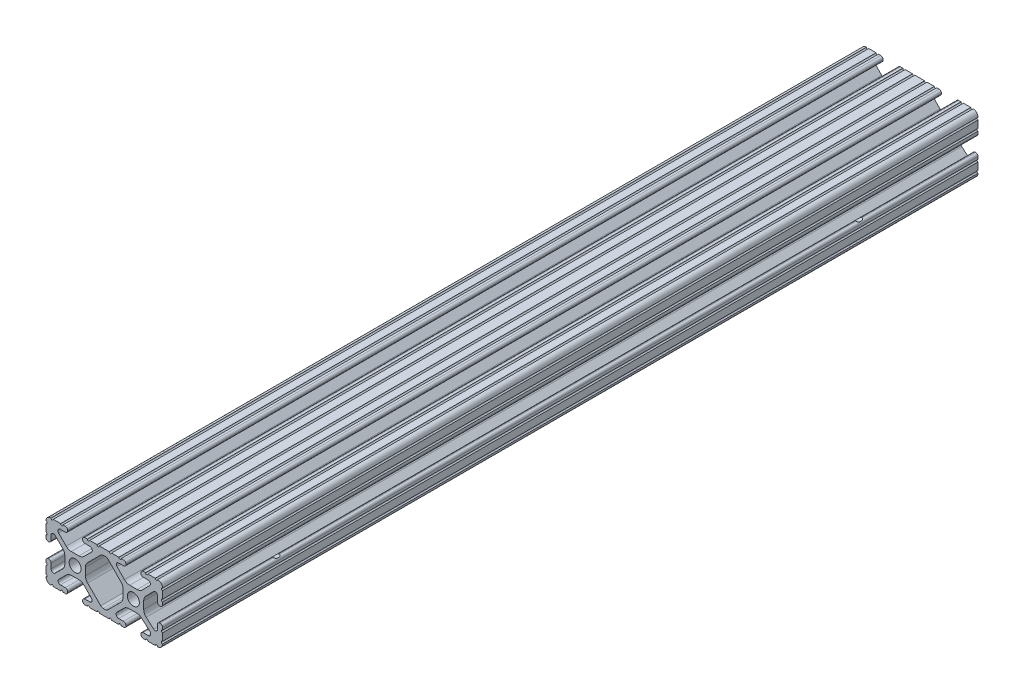
from build123d import *

# Parameters (mm, degrees)
SKETCH1_R           = 2.6035
BOSS_EXTRUDE1_DEPTH = 177.8
SKETCH2_R           = 3.5
CUT_EXTRUDE1_DEPTH  = 186.350397895


with BuildPart() as part:
    # Sketch1 → Boss-Extrude1 (new, symmetric)
    with BuildSketch(Plane.XY):
        with BuildLine():
            Line((18.01710265, 12.7), (16.98745015, 12.7))
            ThreePointArc((16.98745015, 12.7), (16.245730386, 12.392769614), (15.9385, 11.65104985))
            Line((15.9385, 11.65104985), (15.9385, 11.53922))
            ThreePointArc((15.9385, 11.53922), (16.245750844, 10.797450844), (16.98752, 10.4902))
            Line((16.98752, 10.4902), (19.116384363, 10.4902))
            ThreePointArc((19.116384363, 10.4902), (20.052502933, 9.869096983), (19.844087081, 8.765172272))
            Line((19.844087081, 8.765172272), (16.618993479, 5.455112286))
            ThreePointArc((16.618993479, 5.455112286), (15.578994274, 4.745442459), (14.344932584, 4.4958))
            Line((14.344932584, 4.4958), (11.083317835, 4.4958))
            ThreePointArc((11.083317835, 4.4958), (9.854330953, 4.743306833), (8.816955189, 5.447238587))
            Line((8.816955189, 5.447238587), (5.564154119, 8.762652677))
            ThreePointArc((5.564154119, 8.762652677), (5.352591412, 9.867473037), (6.289393385, 10.4902))
            Line((6.289393385, 10.4902), (8.41248, 10.4902))
            ThreePointArc((8.41248, 10.4902), (9.154249156, 10.797450844), (9.4615, 11.53922))
            Line((9.4615, 11.53922), (9.4615, 11.65104985))
            ThreePointArc((9.4615, 11.65104985), (9.154269614, 12.392769614), (8.41254985, 12.7))
            Line((8.41254985, 12.7), (7.38288465, 12.7))
            ThreePointArc((7.38288465, 12.7), (6.87488465, 12.192), (6.36688465, 12.7))
            Line((6.36688465, 12.7), (3.14958095, 12.7))
            ThreePointArc((3.14958095, 12.7), (2.64158095, 12.192), (2.13358095, 12.7))
            Line((2.13358095, 12.7), (-2.13358095, 12.7))
            ThreePointArc((-2.13358095, 12.7), (-2.64158095, 12.192), (-3.14958095, 12.7))
            Line((-3.14958095, 12.7), (-6.36689735, 12.7))
            ThreePointArc((-6.36689735, 12.7), (-6.87489735, 12.192), (-7.38289735, 12.7))
            Line((-7.38289735, 12.7), (-8.41254985, 12.7))
            ThreePointArc((-8.41254985, 12.7), (-9.154269614, 12.392769614), (-9.4615, 11.65104985))
            Line((-9.4615, 11.65104985), (-9.4615, 11.53922))
            ThreePointArc((-9.4615, 11.53922), (-9.154249156, 10.797450844), (-8.41248, 10.4902))
            Line((-8.41248, 10.4902), (-6.283641037, 10.4902))
            ThreePointArc((-6.283641037, 10.4902), (-5.297291557, 9.829633109), (-5.532576693, 8.666071843))
            Line((-5.532576693, 8.666071843), (-8.809985098, 5.416263103))
            ThreePointArc((-8.809985098, 5.416263103), (-9.836720513, 4.734920264), (-11.045536121, 4.4958))
            Line((-11.045536121, 4.4958), (-14.354463879, 4.4958))
            ThreePointArc((-14.354463879, 4.4958), (-15.563279487, 4.734920264), (-16.590014902, 5.416263103))
            Line((-16.590014902, 5.416263103), (-19.867423307, 8.666071843))
            ThreePointArc((-19.867423307, 8.666071843), (-20.102708443, 9.829633109), (-19.116358963, 10.4902))
            Line((-19.116358963, 10.4902), (-16.98752, 10.4902))
            ThreePointArc((-16.98752, 10.4902), (-16.245750844, 10.797450844), (-15.9385, 11.53922))
            Line((-15.9385, 11.53922), (-15.9385, 11.65104985))
            ThreePointArc((-15.9385, 11.65104985), (-16.245730386, 12.392769614), (-16.98745015, 12.7))
            Line((-16.98745015, 12.7), (-18.01711535, 12.7))
            ThreePointArc((-18.01711535, 12.7), (-18.52511535, 12.192), (-19.03311535, 12.7))
            Line((-19.03311535, 12.7), (-22.2504, 12.7))
            ThreePointArc((-22.2504, 12.7), (-22.758323491, 12.192000006), (-23.266399977, 12.699846982))
            ThreePointArc((-23.266399977, 12.699846982), (-24.782522516, 12.082522516), (-25.399846982, 10.566399977))
            ThreePointArc((-25.399846982, 10.566399977), (-24.892000006, 10.058323491), (-25.4, 9.5504))
            Line((-25.4, 9.5504), (-25.4, 6.3330836))
            ThreePointArc((-25.4, 6.3330836), (-24.892, 5.8250836), (-25.4, 5.3170836))
            Line((-25.4, 5.3170836), (-25.4, 4.237520184))
            ThreePointArc((-25.4, 4.237520184), (-25.107393763, 3.531106237), (-24.400979816, 3.2385))
            Line((-24.400979816, 3.2385), (-24.23922, 3.2385))
            ThreePointArc((-24.23922, 3.2385), (-23.497450844, 3.545750844), (-23.1902, 4.28752))
            Line((-23.1902, 4.28752), (-23.1902, 6.334741132))
            ThreePointArc((-23.1902, 6.334741132), (-22.556026952, 7.286023527), (-21.434002553, 7.066535717))
            Line((-21.434002553, 7.066535717), (-18.147950853, 3.808156468))
            ThreePointArc((-18.147950853, 3.808156468), (-17.452759693, 2.774838327), (-17.208501877, 1.553619571))
            Line((-17.208501877, 1.553619571), (-17.208501877, -1.695179196))
            ThreePointArc((-17.208501877, -1.695179196), (-17.450738657, -2.911536421), (-18.140486065, -3.942289578))
            Line((-18.140486065, -3.942289578), (-21.431579576, -7.227386226))
            ThreePointArc((-21.431579576, -7.227386226), (-22.55444896, -7.449940594), (-23.1902, -6.498002195))
            Line((-23.1902, -6.498002195), (-23.1902, -4.28752))
            ThreePointArc((-23.1902, -4.28752), (-23.497450844, -3.545750844), (-24.23922, -3.2385))
            Line((-24.23922, -3.2385), (-24.35098, -3.2385))
            ThreePointArc((-24.35098, -3.2385), (-25.092749156, -3.545750844), (-25.4, -4.28752))
            Line((-25.4, -4.28752), (-25.4, -5.3171344))
            ThreePointArc((-25.4, -5.3171344), (-24.892, -5.8251344), (-25.4, -6.3331344))
            Line((-25.4, -6.3331344), (-25.4, -9.5504))
            ThreePointArc((-25.4, -9.5504), (-24.892000006, -10.058323491), (-25.399846982, -10.566399977))
            ThreePointArc((-25.399846982, -10.566399977), (-24.782522516, -12.082522516), (-23.266399977, -12.699846982))
            ThreePointArc((-23.266399977, -12.699846982), (-22.758323491, -12.192000006), (-22.2504, -12.7))
            Line((-22.2504, -12.7), (-19.03308995, -12.7))
            ThreePointArc((-19.03308995, -12.7), (-18.52508995, -12.192), (-18.01708995, -12.7))
            Line((-18.01708995, -12.7), (-16.9874692, -12.7))
            ThreePointArc((-16.9874692, -12.7), (-16.245700044, -12.392749156), (-15.9384492, -11.65098))
            Line((-15.9384492, -11.65098), (-15.9384492, -11.53922))
            ThreePointArc((-15.9384492, -11.53922), (-16.245700044, -10.797450844), (-16.9874692, -10.4902))
            Line((-16.9874692, -10.4902), (-19.116358963, -10.4902))
            ThreePointArc((-19.116358963, -10.4902), (-20.055197748, -9.862578342), (-19.834124023, -8.755124678))
            Line((-19.834124023, -8.755124678), (-16.49660751, -5.423689618))
            ThreePointArc((-16.49660751, -5.423689618), (-15.467274017, -4.736928798), (-14.253591699, -4.4958))
            Line((-14.253591699, -4.4958), (-11.146408301, -4.4958))
            ThreePointArc((-11.146408301, -4.4958), (-9.932725983, -4.736928798), (-8.90339249, -5.423689618))
            Line((-8.90339249, -5.423689618), (-5.565875977, -8.755124678))
            ThreePointArc((-5.565875977, -8.755124678), (-5.344802252, -9.862578342), (-6.283641037, -10.4902))
            Line((-6.283641037, -10.4902), (-8.4125308, -10.4902))
            ThreePointArc((-8.4125308, -10.4902), (-9.154299956, -10.797450844), (-9.4615508, -11.53922))
            Line((-9.4615508, -11.53922), (-9.4615508, -11.65098))
            ThreePointArc((-9.4615508, -11.65098), (-9.154299956, -12.392749156), (-8.4125308, -12.7))
            Line((-8.4125308, -12.7), (-7.38287195, -12.7))
            ThreePointArc((-7.38287195, -12.7), (-6.87487195, -12.192), (-6.36687195, -12.7))
            Line((-6.36687195, -12.7), (-3.14960635, -12.7))
            ThreePointArc((-3.14960635, -12.7), (-2.64160635, -12.192), (-2.13360635, -12.7))
            Line((-2.13360635, -12.7), (2.13360635, -12.7))
            ThreePointArc((2.13360635, -12.7), (2.64159365, -12.1920127), (3.14958095, -12.7))
            Line((3.14958095, -12.7), (6.36691005, -12.7))
            ThreePointArc((6.36691005, -12.7), (6.87491005, -12.192), (7.38291005, -12.7))
            Line((7.38291005, -12.7), (8.4125308, -12.7))
            ThreePointArc((8.4125308, -12.7), (9.154299956, -12.392749156), (9.4615508, -11.65098))
            Line((9.4615508, -11.65098), (9.4615508, -11.53922))
            ThreePointArc((9.4615508, -11.53922), (9.154299956, -10.797450844), (8.4125308, -10.4902))
            Line((8.4125308, -10.4902), (6.289393385, -10.4902))
            ThreePointArc((6.289393385, -10.4902), (5.231590322, -9.783049717), (5.480677245, -8.535265862))
            Line((5.480677245, -8.535265862), (8.597933595, -5.423689618))
            ThreePointArc((8.597933595, -5.423689618), (9.627267088, -4.736928798), (10.840949406, -4.4958))
            Line((10.840949406, -4.4958), (14.102564155, -4.4958))
            ThreePointArc((14.102564155, -4.4958), (15.215927525, -4.697410182), (16.187895372, -5.276636531))
            Line((16.187895372, -5.276636531), (19.868247549, -8.482246082))
            ThreePointArc((19.868247549, -8.482246082), (20.188435806, -9.746879864), (19.116384363, -10.4902))
            Line((19.116384363, -10.4902), (16.9874692, -10.4902))
            ThreePointArc((16.9874692, -10.4902), (16.245700044, -10.797450844), (15.9384492, -11.53922))
            Line((15.9384492, -11.53922), (15.9384492, -11.65098))
            ThreePointArc((15.9384492, -11.65098), (16.245700044, -12.392749156), (16.9874692, -12.7))
            Line((16.9874692, -12.7), (18.01710265, -12.7))
            ThreePointArc((18.01710265, -12.7), (18.52510265, -12.192), (19.03310265, -12.7))
            Line((19.03310265, -12.7), (22.2504, -12.7))
            ThreePointArc((22.2504, -12.7), (22.758323491, -12.192000006), (23.266399977, -12.699846982))
            ThreePointArc((23.266399977, -12.699846982), (24.782522516, -12.082522516), (25.399846982, -10.566399977))
            ThreePointArc((25.399846982, -10.566399977), (24.892000006, -10.058323492), (25.4, -9.550400001))
            Line((25.4, -9.550400001), (25.4, -6.333083592))
            ThreePointArc((25.4, -6.333083592), (24.892000001, -5.825083593), (25.4, -5.317083593))
            Line((25.4, -5.317083593), (25.4, -4.237520184))
            ThreePointArc((25.4, -4.237520184), (25.107393763, -3.531106237), (24.400979816, -3.2385))
            Line((24.400979816, -3.2385), (24.189220184, -3.2385))
            ThreePointArc((24.189220184, -3.2385), (23.482806237, -3.531106237), (23.1902, -4.237520184))
            Line((23.1902, -4.237520184), (23.1902, -6.155876159))
            ThreePointArc((23.1902, -6.155876159), (22.62232736, -7.038258539), (21.583974541, -6.886926384))
            Line((21.583974541, -6.886926384), (18.29817066, -4.024970844))
            ThreePointArc((18.29817066, -4.024970844), (17.493730985, -2.946044689), (17.208501877, -1.630807374))
            Line((17.208501877, -1.630807374), (17.208501877, 1.630807374))
            ThreePointArc((17.208501877, 1.630807374), (17.442348332, 2.82673414), (18.109440981, 3.846495088))
            Line((18.109440981, 3.846495088), (21.526346532, 7.353420386))
            ThreePointArc((21.526346532, 7.353420386), (22.585896263, 7.574939077), (23.1902, 6.676867167))
            Line((23.1902, 6.676867167), (23.1902, 4.237520184))
            ThreePointArc((23.1902, 4.237520184), (23.482806237, 3.531106237), (24.189220184, 3.2385))
            Line((24.189220184, 3.2385), (24.400979816, 3.2385))
            ThreePointArc((24.400979816, 3.2385), (25.107393763, 3.531106237), (25.4, 4.237520184))
            Line((25.4, 4.237520184), (25.4, 5.3170836))
            ThreePointArc((25.4, 5.3170836), (24.891949193, 5.825134407), (25.4, 6.333185215))
            Line((25.4, 6.333185215), (25.4, 9.550400015))
            ThreePointArc((25.4, 9.550400015), (24.892000013, 10.058323498), (25.399846982, 10.566399977))
            ThreePointArc((25.399846982, 10.566399977), (24.782522516, 12.082522516), (23.266399977, 12.699846982))
            ThreePointArc((23.266399977, 12.699846982), (22.758323491, 12.192000006), (22.2504, 12.7))
            Line((22.2504, 12.7), (19.03310265, 12.7))
            ThreePointArc((19.03310265, 12.7), (18.52510265, 12.192), (18.01710265, 12.7))
        make_face()
        with Locations((-12.7, 0)):
            Circle(SKETCH1_R, mode=Mode.SUBTRACT)
        with Locations((12.7, 0)):
            Circle(SKETCH1_R, mode=Mode.SUBTRACT)
        with BuildLine():
            Line((-7.259513935, -3.869413038), (-1.545748891, -9.572766749))
            ThreePointArc((-1.545748891, -9.572766749), (-1.035199478, -9.913400116), (-0.433213048, -10.033))
            Line((-0.433213048, -10.033), (0.433213048, -10.033))
            ThreePointArc((0.433213048, -10.033), (1.035199478, -9.913400116), (1.545748891, -9.572766749))
            Line((1.545748891, -9.572766749), (7.259513935, -3.869413038))
            ThreePointArc((7.259513935, -3.869413038), (7.949261343, -2.838659881), (8.191498123, -1.622302656))
            Line((8.191498123, -1.622302656), (8.191498123, 1.622302656))
            ThreePointArc((8.191498123, 1.622302656), (7.955573352, 2.823327967), (7.282860769, 3.845864069))
            Line((7.282860769, 3.845864069), (1.675572808, 9.561086461))
            ThreePointArc((1.675572808, 9.561086461), (1.161034429, 9.910236611), (0.551456936, 10.033))
            Line((0.551456936, 10.033), (-0.395199982, 10.033))
            ThreePointArc((-0.395199982, 10.033), (-0.994772524, 9.914396349), (-1.50403329, 9.576450301))
            Line((-1.50403329, 9.576450301), (-7.252049147, 3.876839553))
            ThreePointArc((-7.252049147, 3.876839553), (-7.947240307, 2.843521412), (-8.191498123, 1.622302656))
            Line((-8.191498123, 1.622302656), (-8.191498123, -1.622302656))
            ThreePointArc((-8.191498123, -1.622302656), (-7.949261343, -2.838659881), (-7.259513935, -3.869413038))
        make_face(mode=Mode.SUBTRACT)
    extrude(amount=BOSS_EXTRUDE1_DEPTH, both=True)

    # Sketch2 → Cut-Extrude1 (cut, through all)
    with BuildSketch(Plane(origin=(25.4, 0, 0), x_dir=(0, 0, -1), z_dir=(1, 0, 0))):
        with Locations((-127, 0)):
            Circle(SKETCH2_R)
    cut_extrude1 = extrude(amount=-CUT_EXTRUDE1_DEPTH, mode=Mode.SUBTRACT)

    # Mirror1: Cut-Extrude1 across plane
    add(cut_extrude1.mirror(Plane.XY), mode=Mode.SUBTRACT)


solid = part.part
